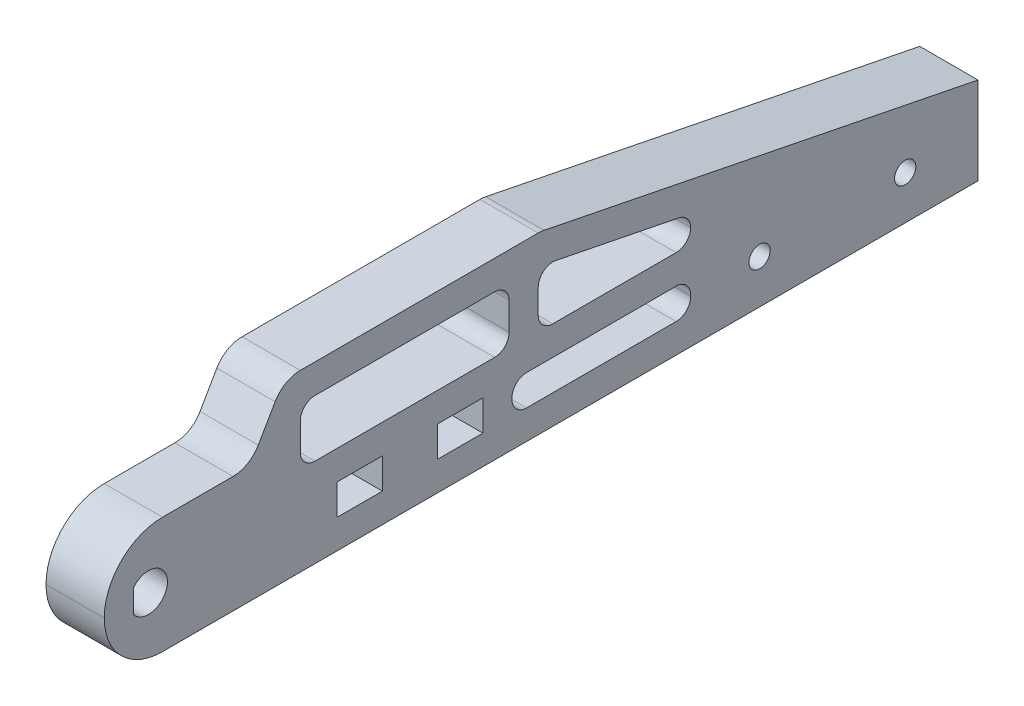
from build123d import *

# Parameters (mm, degrees)
BOSS_EXTRUDE1_DEPTH     = 10
CUT_EXTRUDE2_DEPTH      = 154.297097168
FILLET1_R               = 10
FILLET2_R               = 5
CUT_EXTRUDE3_DEPTH      = 154.297097168
CUT_EXTRUDE3_DEPTH_BACK = 154.297097168
SKETCH3_W               = 7.75
SKETCH3_H               = 5.25
CUT_EXTRUDE6_DEPTH      = 154.297097168
CUT_EXTRUDE6_DEPTH_BACK = 154.297097168
SKETCH6_R               = 1.825
FILLET3_R               = 5
CUT_EXTRUDE7_DEPTH      = 154.297097168
CUT_EXTRUDE7_DEPTH_BACK = 154.297097168
SKETCH7_W               = 35.844648394
SKETCH7_H               = 9.75
SKETCH7_W_2             = 30.675
SKETCH7_H_2             = 5.25
FILLET4_R               = 2.5


# Some blends are built 0.0001 mm under size
with BuildPart() as part:
    # Sketch1 → Boss-Extrude1 (new body)
    with BuildSketch(Plane(origin=(0, 0, 0), x_dir=(0, 0, -1), z_dir=(1, 0, 0))):
        Polygon((0, 0), (150, 0), (150, 15), (75, 30), (30.773502692, 30), (25, 20), (0, 20), align=None)
    extrude(amount=-BOSS_EXTRUDE1_DEPTH)

    # Sketch2 → Cut-Extrude2 (cut, through all)
    with BuildSketch(Plane(origin=(0, 0, 0), x_dir=(0, 0, -1), z_dir=(1, 0, 0))):
        with BuildLine():
            Line((5, 11.964942747), (5, 8.035057253))
            ThreePointArc((5, 8.035057253), (10.85, 10), (5, 11.964942747))
        make_face()
    extrude(amount=-CUT_EXTRUDE2_DEPTH, mode=Mode.SUBTRACT)

    # Fillet1
    fillet1_edges = [part.edges().sort_by_distance(p)[0] for p in [
        (-5, 0, 0),
        (-5, 20, 0),
    ]]
    fillet(fillet1_edges, radius=FILLET1_R - 0.0001)  # a hair under: the kernel refuses the full size

    # Fillet2
    fillet2_edges = [part.edges().sort_by_distance(p)[0] for p in [
        (-5, 30, -30.773502692),
        (-5, 30, -75),
    ]]
    fillet(fillet2_edges, radius=FILLET2_R)

    # Sketch3 → Cut-Extrude3 (cut, two sides: drawn at the far end of the back side and taken through both)
    with BuildSketch(Plane(origin=(0, 0, 0), x_dir=(0, 0, -1), z_dir=(1, 0, 0)).offset(-CUT_EXTRUDE3_DEPTH_BACK)):
        with Locations((61.125, 7.625)):
            Rectangle(SKETCH3_W, SKETCH3_H)
        with Locations((43.875, 7.625)):
            Rectangle(SKETCH3_W, SKETCH3_H)
    extrude(amount=CUT_EXTRUDE3_DEPTH + CUT_EXTRUDE3_DEPTH_BACK, mode=Mode.SUBTRACT)

    # Sketch6 → Cut-Extrude6 (cut, two sides: drawn at the far end of the back side and taken through both)
    with BuildSketch(Plane(origin=(0, 0, 0), x_dir=(0, 0, -1), z_dir=(1, 0, 0)).offset(-CUT_EXTRUDE6_DEPTH_BACK)):
        with Locations((112.5, 7.5)):
            Circle(SKETCH6_R)
        with Locations((137.5, 7.5)):
            Circle(SKETCH6_R)
    extrude(amount=CUT_EXTRUDE6_DEPTH + CUT_EXTRUDE6_DEPTH_BACK, mode=Mode.SUBTRACT)

    # Fillet3
    fillet3_edges = [part.edges().sort_by_distance(p)[0] for p in [
        (-5, 20, -25),
    ]]
    fillet(fillet3_edges, radius=FILLET3_R)

    # Sketch7 → Cut-Extrude7 (cut, two sides: drawn at the far end of the back side and taken through both)
    with BuildSketch(Plane(origin=(0, 0, 0), x_dir=(0, 0, -1), z_dir=(1, 0, 0)).offset(-CUT_EXTRUDE7_DEPTH_BACK)):
        with Locations((51.582578235, 20.125)):
            Rectangle(SKETCH7_W, SKETCH7_H)
        with Locations((85.3375, 7.625)):
            Rectangle(SKETCH7_W_2, SKETCH7_H_2)
        Polygon((100.675, 15.25), (100.675, 19.765980486), (74.504902432, 25), (74.504902432, 15.25), align=None)
    extrude(amount=CUT_EXTRUDE7_DEPTH + CUT_EXTRUDE7_DEPTH_BACK, mode=Mode.SUBTRACT)

    # Fillet4
    # the kernel refuses this fillet: 2.5 mm, written as the material it adds along each edge
    with BuildSketch(Plane(origin=(0, 15.25, -69.504902432), x_dir=(0, 0, 1), z_dir=(-1, 0, 0)), Plane(origin=(-10, 25, -33.660254038), x_dir=(0, -1, 0), z_dir=(1, 0, 0)), Plane(origin=(0, 25, -69.504902432), x_dir=(0, -1, 0), z_dir=(-1, 0, 0)), Plane(origin=(0, 15.25, -74.504902432), x_dir=(0, 1, 0), z_dir=(-1, 0, 0)), Plane(origin=(0, 15.25, -100.675), x_dir=(0, 0, 1), z_dir=(-1, 0, 0)), Plane(origin=(0, 5, -100.675), x_dir=(0, 0, 1), z_dir=(-1, 0, 0))) as fillet4_piece_1:
        with BuildLine():
            CenterArc((FILLET4_R, FILLET4_R), FILLET4_R, 180, 90)
            Line((0, FILLET4_R), (0, 0))
            Line((0, 0), (FILLET4_R, 0))
        make_face()
    extrude(amount=10)
    with BuildSketch(Plane(origin=(-10, 15.25, -33.660254038), x_dir=(0, 1, 0), z_dir=(1, 0, 0)), Plane(origin=(-10, 5, -70), x_dir=(0, 1, 0), z_dir=(1, 0, 0)), Plane(origin=(-10, 10.25, -70), x_dir=(0, 0, -1), z_dir=(1, 0, 0)), Plane(origin=(0, 10.25, -100.675), x_dir=(0, 0, 1), z_dir=(-1, 0, 0))) as fillet4_piece_2:
        with BuildLine():
            CenterArc((FILLET4_R, -FILLET4_R), FILLET4_R, 90, 90)
            Line((0, -FILLET4_R), (0, 0))
            Line((0, 0), (FILLET4_R, 0))
        make_face()
    extrude(amount=10)
    with BuildSketch(Plane(origin=(-10, 25, -74.504902432), x_dir=(0, -0.1961161351381845, -0.9805806756909201), z_dir=(1, 0, 0))) as fillet4_piece_3:
        with BuildLine():
            CenterArc((FILLET4_R * 1.21980390272, -FILLET4_R), FILLET4_R, 90, 101.309932474)
            Line((FILLET4_R * 0.239223227028, -FILLET4_R * 1.19611613514), (0, 0))
            Line((0, 0), (FILLET4_R * 1.21980390272, 0))
        make_face()
    extrude(amount=10)
    with BuildSketch(Plane(origin=(-10, 19.765980486, -100.675), x_dir=(0, 0.19611613513818169, 0.9805806756909206), z_dir=(1, 0, 0))) as fillet4_piece_4:
        with BuildLine():
            CenterArc((FILLET4_R * 0.819803902719, FILLET4_R), FILLET4_R, 191.309932474, 78.690067526)
            Line((-FILLET4_R * 0.160776772972, FILLET4_R * 0.803883864862), (0, 0))
            Line((0, 0), (FILLET4_R * 0.819803902719, 0))
        make_face()
    extrude(amount=10)


solid = part.part
